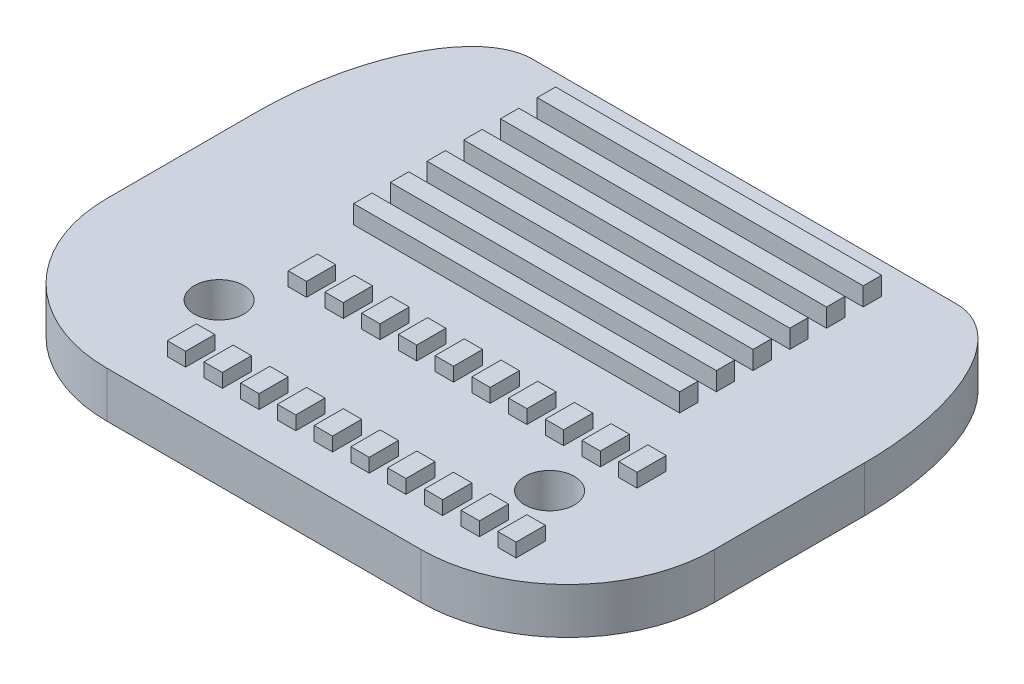
from build123d import *

# Parameters (mm, degrees)
SKETCH8_W                  = 33.098892865
SKETCH8_H                  = 26.166292272
BOSS_EXTRUDE5_DEPTH        = 2.5
M2_5_CLEARANCE_HOLE2_D     = 2.7
M2_5_CLEARANCE_HOLE2_DEPTH = 11.188838164
M2_5_CLEARANCE_HOLE2_TIP   = 0.811161836
SKETCH11_W                 = 1
SKETCH11_H                 = 1.5875
BOSS_EXTRUDE6_DEPTH        = 0.75
LPATTERN1_COUNT            = 10
LPATTERN1_PITCH            = 2
SKETCH11_4_W               = 17.754847744
SKETCH11_4_H               = 1
BOSS_EXTRUDE8_DEPTH        = 1
LPATTERN3_COUNT            = 6
LPATTERN3_PITCH            = 2
FILLET5_R                  = 8
FILLET8_SIZE               = 10
FILLET8_SIZE_2             = 5
FILLET9_SIZE               = 10
FILLET9_SIZE_2             = 5


with BuildPart() as part:
    # Sketch8 → Boss-Extrude5 (new body)
    with BuildSketch(Plane(origin=(0, 0, 0), x_dir=(1, 0, 0), z_dir=(0, 1, 0))):
        with Locations((16.549446433, 13.083146136)):
            Rectangle(SKETCH8_W, SKETCH8_H)
    extrude(amount=-BOSS_EXTRUDE5_DEPTH)

    # M2.5 Clearance Hole2
    with Locations(Plane(origin=(0, 0, 0), x_dir=(1, 0, 0), z_dir=(0, 1, 0))):
        with Locations((7.835608917, 6.278792272), (25.835608917, 6.278792272)):
            Hole(M2_5_CLEARANCE_HOLE2_D / 2, depth=M2_5_CLEARANCE_HOLE2_DEPTH)
            with Locations((0, 0, -(M2_5_CLEARANCE_HOLE2_DEPTH + M2_5_CLEARANCE_HOLE2_TIP / 2))):  # 118° drill point
                Cone(0, M2_5_CLEARANCE_HOLE2_D / 2, M2_5_CLEARANCE_HOLE2_TIP, mode=Mode.SUBTRACT)

    # Sketch11 → Boss-Extrude6 (add)
    with BuildSketch(Plane(origin=(0, 0, 0), x_dir=(1, 0, 0), z_dir=(0, 1, 0))):
        with Locations((27.598892865, 9.572542272)):
            Rectangle(SKETCH11_W, SKETCH11_H)
        with Locations((27.598892865, 2.985042272)):
            Rectangle(SKETCH11_W, SKETCH11_H)
    boss_extrude6 = extrude(amount=BOSS_EXTRUDE6_DEPTH)

    # LPattern1: Boss-Extrude6 ×10
    with Locations(*[(-i * LPATTERN1_PITCH, 0, 0) for i in range(1, LPATTERN1_COUNT)]):
        add(boss_extrude6)

    # Sketch11<4> → Boss-Extrude8 (add)
    with BuildSketch(Plane(origin=(0, 0, 0), x_dir=(1, 0, 0), z_dir=(0, 1, 0))):
        with Locations((16.835608917, 13.981416476)):
            Rectangle(SKETCH11_4_W, SKETCH11_4_H)
    boss_extrude8 = extrude(amount=BOSS_EXTRUDE8_DEPTH)

    # LPattern3: Boss-Extrude8 ×6
    with Locations(*[(0, 0, -i * LPATTERN3_PITCH) for i in range(1, LPATTERN3_COUNT)]):
        add(boss_extrude8)

    # Fillet5
    fillet5_edges = [part.edges().sort_by_distance(p)[0] for p in [
        (33.098892865, -1.25, 0),
        (0, -1.25, 0),
    ]]
    fillet(fillet5_edges, radius=FILLET5_R)

    # Fillet8
    # an asymmetric fillet: 10, 5 mm, written as the material it takes off along each edge
    with BuildSketch(Plane(origin=(33.098892865, 25, -26.166292272), x_dir=(0, 0, 1), z_dir=(0, -1, 0))) as fillet8_piece_1:
        with BuildLine():
            Bezier((FILLET8_SIZE, 0), (0, 0), (0, FILLET8_SIZE_2), weights=[1, 0.707106781, 1])
            Line((0, FILLET8_SIZE_2), (0, 0))
            Line((0, 0), (FILLET8_SIZE, 0))
        make_face()
    extrude(amount=52.5, mode=Mode.SUBTRACT)

    # Fillet9
    # an asymmetric fillet: 10, 5 mm, written as the material it takes off along each edge
    with BuildSketch(Plane(origin=(0, 25, -26.166292272), x_dir=(0, 0, 1), z_dir=(0, -1, 0))) as fillet9_piece_1:
        with BuildLine():
            Bezier((FILLET9_SIZE, 0), (0, 0), (0, -FILLET9_SIZE_2), weights=[1, 0.707106781, 1])
            Line((0, -FILLET9_SIZE_2), (0, 0))
            Line((0, 0), (FILLET9_SIZE, 0))
        make_face()
    extrude(amount=52.5, mode=Mode.SUBTRACT)


solid = part.part
